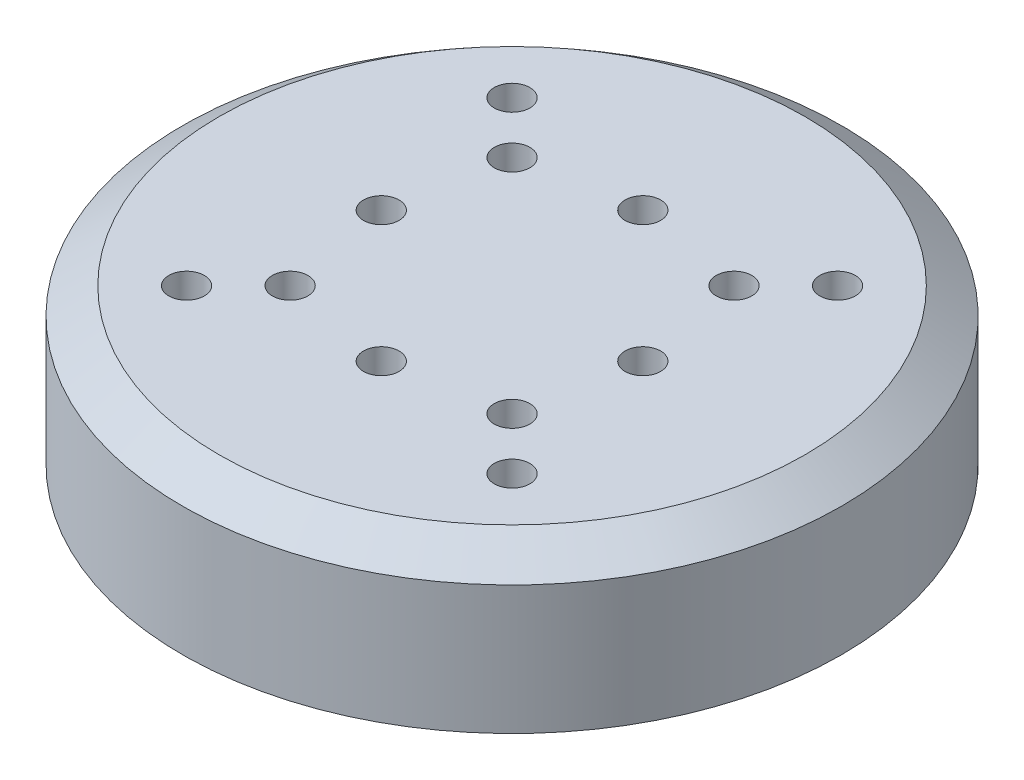
from build123d import *

# Parameters (mm, degrees)
M3_CLEARANCE_HOLE1_D     = 3.4
M3_CLEARANCE_HOLE1_DEPTH = 4
M3_CLEARANCE_HOLE1_TIP   = 1.021463052
SKETCH5_R                = 29.5
CUT_EXTRUDE1_DEPTH       = 1


with BuildPart() as part:
    # Sketch1 → Revolve1 (revolve)
    with BuildSketch(Plane.XY):
        Polygon((0, -7.4), (0, 7.4), (-28, 7.4), (-31.5, 4.9), (-31.5, -7.4), align=None)
    revolve(axis=Axis((0, -7.4, 0), (0, 1, 0)))

    # M3 Clearance Hole1
    with Locations(Plane(origin=(0, 7.4, 0), x_dir=(1, 0, 0), z_dir=(0, 1, 0))):
        with Locations((-15.556349186, 15.556349186), (-10.606601718, 10.606601718), (0, 12.5), (10.606601718, 10.606601718), (15.556349186, 15.556349186), (0, -12.5), (-12.5, 0), (12.5, 0), (10.606601718, -10.606601718), (-10.606601718, -10.606601718), (-15.556349186, -15.556349186), (15.556349186, -15.556349186)):
            Hole(M3_CLEARANCE_HOLE1_D / 2, depth=M3_CLEARANCE_HOLE1_DEPTH)
            with Locations((0, 0, -(M3_CLEARANCE_HOLE1_DEPTH + M3_CLEARANCE_HOLE1_TIP / 2))):  # 118° drill point
                Cone(0, M3_CLEARANCE_HOLE1_D / 2, M3_CLEARANCE_HOLE1_TIP, mode=Mode.SUBTRACT)

    # Sketch5 → Cut-Extrude1 (cut)
    with BuildSketch(Plane.XZ.offset(7.4)):
        Circle(SKETCH5_R)
    extrude(amount=-CUT_EXTRUDE1_DEPTH, mode=Mode.SUBTRACT)


solid = part.part
